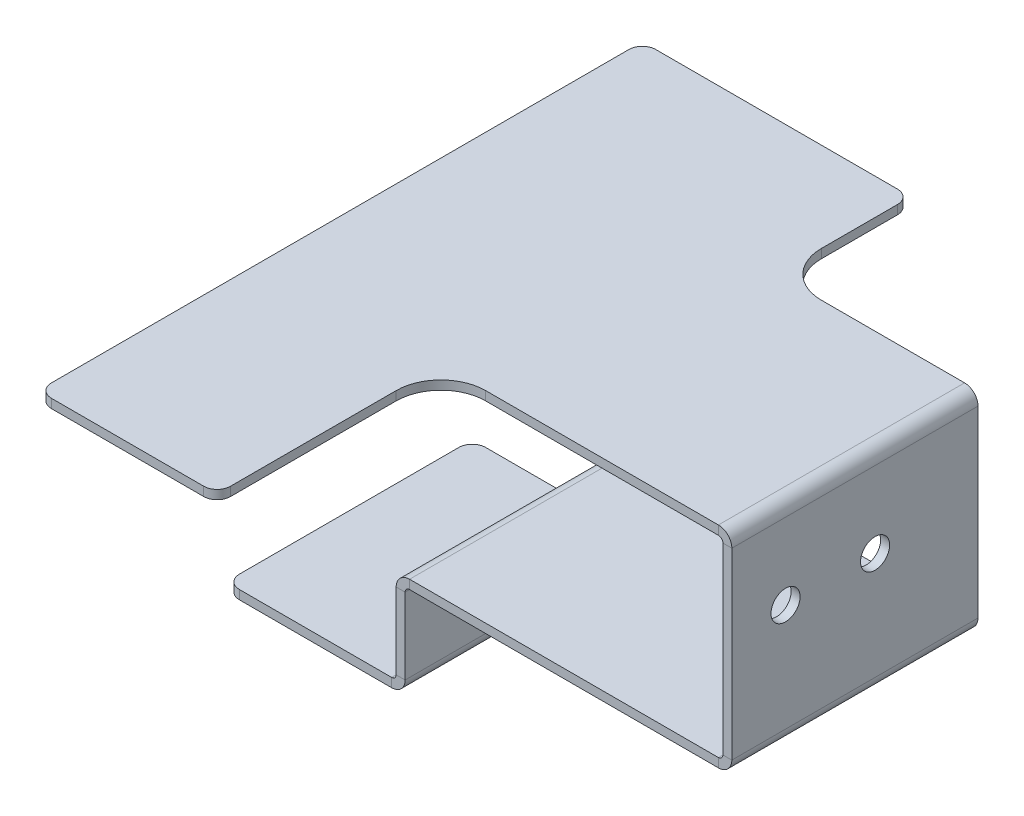
from build123d import *

# Parameters (mm, degrees)
EXTRUDE_1_DEPTH             = 55
EXTRUDE_3_DEPTH             = 2
CUT_EXTRUDE_1_REACH         = 169.242
SKETCH_6_R                  = 3.25
FILLET_1_R                  = 3
SHEET_METAL_1_OUTLINE_W     = 2
SHEET_METAL_1_OUTLINE_H     = 135
SHEET_METAL_1_OUTLINE_W_2   = 23
SHEET_METAL_1_OUTLINE_H_2   = 55
SHEET_METAL_1_DEPTH         = 111
SHEET_START                 = 111
SHEET_METAL_1_2_DEPTH       = 2
SHEET_START_2               = -30
SHEET_METAL_1_3_DEPTH       = 135
SHEET_METAL_1_3_2_DEPTH     = 55
SHEET_METAL_1_3_3_OUTLINE_W = 40
SHEET_METAL_1_3_3_OUTLINE_H = 2
SHEET_METAL_1_3_3_DEPTH     = 135
SHEET_METAL_1_3_4_OUTLINE_W = 20
SHEET_METAL_1_3_4_OUTLINE_H = 2
SHEET_METAL_1_3_4_DEPTH     = 95
SHEET_START_3               = -10
SHEET_METAL_1_3_5_DEPTH     = 10
SHEET_START_4               = -1
SHEET_METAL_1_3_6_DEPTH     = 70


with BuildPart() as part:
    # Sketch 2 → 凸台-拉伸1 (new body)
    with BuildSketch(Plane.XY):
        Polygon((0, 0), (40, 0), (40, 21), (113, 21), (113, 68), (8, 68), (8, 66), (111, 66), (111, 23), (38, 23), (38, 2), (0, 2), align=None)
    extrude(amount=EXTRUDE_1_DEPTH)

    # 草图4 → 凸台-拉伸3 (add)
    with BuildSketch(Plane(origin=(0, 68, 0), x_dir=(1, 0, 0), z_dir=(0, 1, 0))):
        with BuildLine():
            Line((8, 27), (8, 0))
            Line((8, 0), (78, 0))
            ThreePointArc((78, 0), (70.928932188, 2.928932188), (68, 10))
            Line((68, 10), (68, 27))
            ThreePointArc((68, 27), (67.121320344, 29.121320344), (65, 30))
            Line((65, 30), (11, 30))
            ThreePointArc((11, 30), (8.878679656, 29.121320344), (8, 27))
        make_face()
        with BuildLine():
            Line((58, -55), (8, -55))
            Line((8, -55), (8, -102))
            ThreePointArc((8, -102), (8.878679656, -104.121320344), (11, -105))
            Line((11, -105), (45, -105))
            ThreePointArc((45, -105), (47.121320344, -104.121320344), (48, -102))
            Line((48, -102), (48, -65))
            ThreePointArc((48, -65), (50.928932188, -57.928932188), (58, -55))
        make_face()
    extrude(amount=-EXTRUDE_3_DEPTH)

    # 草图6 → 切除-拉伸1 (cut, up to next)
    with BuildSketch(Plane.ZY.offset(-111), mode=Mode.PRIVATE) as cut_extrude_1_sk1:
        with Locations((23, 48)):
            Circle(SKETCH_6_R)
    cut_extrude_1_tool1 = extrude(cut_extrude_1_sk1.sketch, amount=-CUT_EXTRUDE_1_REACH, mode=Mode.PRIVATE) & part.part
    # 草图6 → 切除-拉伸1 (cut, up to next)
    with BuildSketch(Plane.ZY.offset(-111), mode=Mode.PRIVATE) as cut_extrude_1_sk2:
        with Locations((43, 48)):
            Circle(SKETCH_6_R)
    cut_extrude_1_tool2 = extrude(cut_extrude_1_sk2.sketch, amount=-CUT_EXTRUDE_1_REACH, mode=Mode.PRIVATE) & part.part
    add(cut_extrude_1_tool1.solids().sort_by_distance((111, 48, 23))[0], mode=Mode.SUBTRACT)
    add(cut_extrude_1_tool2.solids().sort_by_distance((111, 48, 43))[0], mode=Mode.SUBTRACT)

    # 圆角1
    fillet_1_edges = [part.edges().sort_by_distance(p)[0] for p in [
        (0, 1, 0),
        (0, 1, 55),
    ]]
    fillet(fillet_1_edges, radius=FILLET_1_R)

    # Sheet Metal 1: read off the stored shape, not the designer's step
    # Sheet Metal 1 outline → Sheet Metal 1 (cut)
    with BuildSketch(Plane.YZ):
        with Locations((67, 37.5)):
            Rectangle(SHEET_METAL_1_OUTLINE_W, SHEET_METAL_1_OUTLINE_H)
        with Locations((11.5, 27.5)):
            Rectangle(SHEET_METAL_1_OUTLINE_W_2, SHEET_METAL_1_OUTLINE_H_2)
    extrude(amount=SHEET_METAL_1_DEPTH, mode=Mode.SUBTRACT)

    # Sheet Metal 1 2 outline → Sheet Metal 1 2 (add)
    with BuildSketch(Plane.YZ.offset(SHEET_START)):
        with BuildLine():
            Line((68, 0), (100, 0))
            ThreePointArc((100, 0), (107.071067812, -2.928932188), (110, -10))
            Line((110, -10), (110, -27))
            ThreePointArc((110, -27), (110.878679656, -29.121320344), (113, -30))
            Line((113, -30), (167, -30))
            ThreePointArc((167, -30), (169.121320344, -29.121320344), (170, -27))
            Line((170, -27), (170, 102))
            ThreePointArc((170, 102), (169.121320344, 104.121320344), (167, 105))
            Line((167, 105), (133, 105))
            ThreePointArc((133, 105), (130.878679656, 104.121320344), (130, 102))
            Line((130, 102), (130, 65))
            ThreePointArc((130, 65), (127.071067812, 57.928932188), (120, 55))
            Line((120, 55), (68, 55))
            Line((68, 55), (68, 0))
        make_face()
        with BuildLine():
            Line((21, 0), (21, 55))
            Line((21, 55), (-105, 55))
            ThreePointArc((-105, 55), (-107.121320344, 54.121320344), (-108, 52))
            Line((-108, 52), (-108, 3))
            ThreePointArc((-108, 3), (-107.121320344, 0.878679656), (-105, 0))
            Line((-105, 0), (21, 0))
        make_face()
    extrude(amount=SHEET_METAL_1_2_DEPTH)

    # Sheet Metal 1 3: read off the stored shape, not the designer's step
    # Sheet Metal 1 3 outline → Sheet Metal 1 3 (cut)
    with BuildSketch(Plane.XY.offset(SHEET_START_2)):
        with BuildLine():
            ThreePointArc((113, 24), (112.449489743, 22.267949192), (111, 21.171572875))
            Line((111, 21.171572875), (111, -108))
            Line((111, -108), (113, -108))
            Line((113, -108), (113, 24))
        make_face()
        with BuildLine():
            ThreePointArc((111, 67.828427125), (112.449489743, 66.732050808), (113, 65))
            Line((113, 65), (113, 170))
            Line((113, 170), (111, 170))
            Line((111, 170), (111, 67.828427125))
        make_face()
    extrude(amount=SHEET_METAL_1_3_DEPTH, mode=Mode.SUBTRACT)

    # Sheet Metal 1 3 2 outline → Sheet Metal 1 3 2 (add)
    with BuildSketch(Plane.XY):
        with BuildLine():
            Line((37, 2), (0, 2))
            Line((0, 2), (0, 0))
            Line((0, 0), (37, 0))
            ThreePointArc((37, 0), (39.121320344, 0.878679656), (40, 3))
            Line((40, 3), (40, 20))
            ThreePointArc((40, 20), (40.292893219, 20.707106781), (41, 21))
            Line((41, 21), (110, 21))
            ThreePointArc((110, 21), (110.507305936, 21.043204321), (111, 21.171572875))
            Line((111, 21.171572875), (111, 24))
            ThreePointArc((111, 24), (110.707106781, 23.292893219), (110, 23))
            Line((110, 23), (41, 23))
            ThreePointArc((41, 23), (38.878679656, 22.121320344), (38, 20))
            Line((38, 20), (38, 3))
            ThreePointArc((38, 3), (37.707106781, 2.292893219), (37, 2))
        make_face()
        with BuildLine():
            ThreePointArc((110, 66), (110.707106781, 65.707106781), (111, 65))
            Line((111, 65), (111, 67.828427125))
            ThreePointArc((111, 67.828427125), (110.507305936, 67.956795679), (110, 68))
            Line((110, 68), (8, 68))
            Line((8, 68), (8, 66))
            Line((8, 66), (110, 66))
        make_face()
    extrude(amount=SHEET_METAL_1_3_2_DEPTH)

    # Sheet Metal 1 3 3 outline → Sheet Metal 1 3 3 (add)
    with BuildSketch(Plane.XY.offset(SHEET_START_2)):
        with Locations((28, 67)):
            Rectangle(SHEET_METAL_1_3_3_OUTLINE_W, SHEET_METAL_1_3_3_OUTLINE_H)
    extrude(amount=SHEET_METAL_1_3_3_DEPTH)

    # Sheet Metal 1 3 4 outline → Sheet Metal 1 3 4 (add)
    with BuildSketch(Plane.XY.offset(SHEET_START_2)):
        with Locations((58, 67)):
            Rectangle(SHEET_METAL_1_3_4_OUTLINE_W, SHEET_METAL_1_3_4_OUTLINE_H)
    extrude(amount=SHEET_METAL_1_3_4_DEPTH)

    # Sheet Metal 1 3 5 outline → Sheet Metal 1 3 5 (add)
    with BuildSketch(Plane.XY.offset(SHEET_START_3)):
        with BuildLine():
            Line((68, 68), (68, 66))
            Line((68, 66), (110, 66))
            ThreePointArc((110, 66), (110.707106781, 65.707106781), (111, 65))
            Line((111, 65), (111, 67.828427125))
            ThreePointArc((111, 67.828427125), (110.507305936, 67.956795679), (110, 68))
            Line((110, 68), (68, 68))
        make_face()
    extrude(amount=SHEET_METAL_1_3_5_DEPTH)

    # Sheet Metal 1 3 6 outline → Sheet Metal 1 3 6 (cut)
    with BuildSketch(Plane(origin=(0, 0, 0), x_dir=(1, 0, 0), z_dir=(0, 1, 0)).offset(SHEET_START_4)):
        with BuildLine():
            Line((0, -55), (3, -55))
            ThreePointArc((3, -55), (0.878679656, -54.121320344), (0, -52))
            Line((0, -52), (0, -55))
        make_face()
        with BuildLine():
            Line((0, 0), (0, -3))
            ThreePointArc((0, -3), (0.878679656, -0.878679656), (3, 0))
            Line((3, 0), (0, 0))
        make_face()
        with BuildLine():
            ThreePointArc((11, -105), (8.878679656, -104.121320344), (8, -102))
            Line((8, -102), (8, -105))
            Line((8, -105), (11, -105))
        make_face()
        with BuildLine():
            Line((8, 30), (8, 27))
            ThreePointArc((8, 27), (8.878679656, 29.121320344), (11, 30))
            Line((11, 30), (8, 30))
        make_face()
        with BuildLine():
            ThreePointArc((48, -102), (47.121320344, -104.121320344), (45, -105))
            Line((45, -105), (48, -105))
            Line((48, -105), (48, -102))
        make_face()
        with BuildLine():
            Line((68, 30), (65, 30))
            ThreePointArc((65, 30), (67.121320344, 29.121320344), (68, 27))
            Line((68, 27), (68, 30))
        make_face()
        with BuildLine():
            Line((68, -55), (58, -55))
            ThreePointArc((58, -55), (50.928932188, -57.928932188), (48, -65))
            Line((48, -65), (68, -65))
            Line((68, -65), (68, -55))
        make_face()
        with BuildLine():
            ThreePointArc((68, 10), (70.928932188, 2.928932188), (78, 0))
            Line((78, 0), (111, 0))
            Line((111, 0), (111, 10))
            Line((111, 10), (68, 10))
        make_face()
    extrude(amount=SHEET_METAL_1_3_6_DEPTH, mode=Mode.SUBTRACT)


solid = part.part
